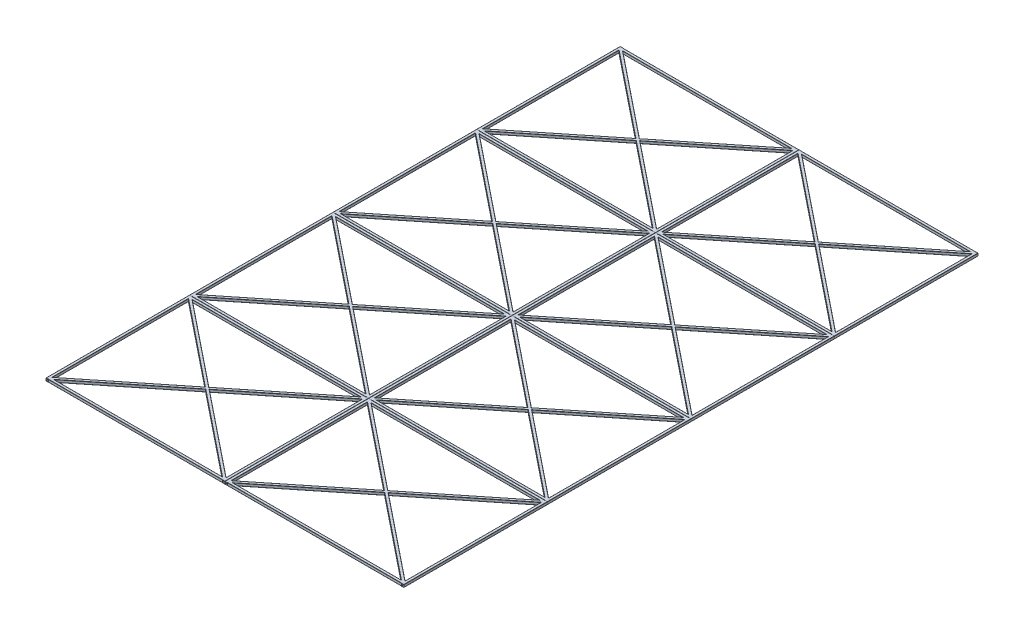
from build123d import *

# Parameters (mm, degrees)
BOSS_EXTRUDE1_DEPTH             = 2125
BOSS_EXTRUDE2_DEPTH             = 2573.8
BOSS_EXTRUDE5_REACH             = 1700.499
BOSS_EXTRUDE5_DIRECTION_2_REACH = 1700.499
BOSS_EXTRUDE7_REACH             = 3326.514
BOSS_EXTRUDE7_DIRECTION_2_REACH = 3326.514
BOSS_EXTRUDE8_REACH             = 3354.589
BOSS_EXTRUDE8_DIRECTION_2_REACH = 3354.589


with BuildPart() as part:
    # Sketch2 → Boss-Extrude1 (new body)
    with BuildSketch(Plane.XY):
        with BuildLine():
            Line((2.540000000000018, 18.93544774013129), (35.55999999999998, 18.93544774013129))
            ThreePointArc((35.55999999999998, 18.93544774013129), (37.35605122421383, 18.191498964345122), (38.1, 16.395447740131274))
            Line((38.1, 16.395447740131274), (38.1, -16.624552259868693))
            ThreePointArc((38.1, -16.624552259868693), (37.35605122421383, -18.42060348408254), (35.55999999999998, -19.16455225986871))
            Line((35.55999999999998, -19.16455225986871), (2.5400000000000222, -19.16455225986871))
            ThreePointArc((2.5400000000000222, -19.16455225986871), (0.7439487757861745, -18.42060348408254), (4.35e-15, -16.624552259868693))
            Line((4.35e-15, -16.624552259868693), (3.1e-16, 16.395447740131274))
            ThreePointArc((3.1e-16, 16.395447740131274), (0.7439487757861709, 18.19149896434512), (2.540000000000018, 18.93544774013129))
        make_face()
        with BuildLine():
            Line((5.308600000000018, 16.166847740131292), (32.791399999999975, 16.166847740131292))
            ThreePointArc((32.791399999999975, 16.166847740131292), (34.58745122421383, 15.422898964345128), (35.3314, 13.626847740131273))
            Line((35.3314, 13.626847740131273), (35.3314, -13.855952259868694))
            ThreePointArc((35.3314, -13.855952259868694), (34.58745122421382, -15.652003484082543), (32.791399999999975, -16.39595225986871))
            Line((32.791399999999975, -16.39595225986871), (5.308600000000018, -16.395952259868707))
            ThreePointArc((5.308600000000018, -16.395952259868707), (3.5125487757861693, -15.652003484082538), (2.7686, -13.85595225986869))
            Line((2.7686, -13.85595225986869), (2.7686, 13.626847740131273))
            ThreePointArc((2.7686, 13.626847740131273), (3.5125487757861693, 15.422898964345121), (5.308600000000018, 16.166847740131292))
        make_face(mode=Mode.SUBTRACT)
    extrude(amount=BOSS_EXTRUDE1_DEPTH)


with BuildPart() as body_2:
    # Mirror2: mirrored copy
    add(part.part.mirror(Plane.ZY.offset(-1325)))


with BuildPart() as part_1:
    add(part.part)

    add(body_2.part)  # Boss-Extrude2 merges body 2
    # Sketch3 → Boss-Extrude2 (add)
    with BuildSketch(Plane.ZY.offset(-2611.9)):
        with BuildLine():
            Line((2.5400000000000182, 18.93544774013129), (35.55999999999999, 18.93544774013129))
            ThreePointArc((35.55999999999999, 18.93544774013129), (37.35605122421383, 18.19149896434512), (38.1, 16.395447740131278))
            Line((38.1, 16.395447740131278), (38.10000000000002, -16.624552259868693))
            ThreePointArc((38.10000000000002, -16.624552259868693), (37.35605122421385, -18.42060348408254), (35.56, -19.16455225986871))
            Line((35.56, -19.16455225986871), (2.5400000000000182, -19.16455225986871))
            ThreePointArc((2.5400000000000182, -19.16455225986871), (0.7439487757861705, -18.42060348408254), (5.3e-16, -16.624552259868693))
            Line((5.3e-16, -16.624552259868693), (5.3e-16, 16.395447740131274))
            ThreePointArc((5.3e-16, 16.395447740131274), (0.7439487757861711, 18.191498964345122), (2.5400000000000182, 18.93544774013129))
        make_face()
        with BuildLine():
            Line((5.308600000000019, 16.166847740131292), (32.791399999999975, 16.166847740131292))
            ThreePointArc((32.791399999999975, 16.166847740131292), (34.58745122421383, 15.422898964345128), (35.3314, 13.626847740131273))
            Line((35.3314, 13.626847740131273), (35.3314, -13.855952259868694))
            ThreePointArc((35.3314, -13.855952259868694), (34.58745122421382, -15.652003484082543), (32.791399999999975, -16.39595225986871))
            Line((32.791399999999975, -16.39595225986871), (5.308600000000017, -16.395952259868707))
            ThreePointArc((5.308600000000017, -16.395952259868707), (3.51254877578617, -15.652003484082538), (2.7686000000000006, -13.85595225986869))
            Line((2.7686000000000006, -13.85595225986869), (2.7686000000000006, 13.626847740131273))
            ThreePointArc((2.7686000000000006, 13.626847740131273), (3.51254877578617, 15.422898964345123), (5.308600000000019, 16.166847740131292))
        make_face(mode=Mode.SUBTRACT)
    boss_extrude2 = extrude(amount=BOSS_EXTRUDE2_DEPTH)

    # Mirror3: Boss-Extrude2 across plane
    add(boss_extrude2.mirror(Plane.XY.offset(1062.5)))

    # Sketch8 → Boss-Extrude5 (add, up to next)
    with BuildSketch(Plane(origin=(1325, 0, 1062.5000000000005), x_dir=(-0.6255921846507733, 0, 0.7801502537997875), z_dir=(-0.7801502537997875, 0, -0.6255921846507733)), mode=Mode.PRIVATE) as boss_extrude5_sk1:
        with BuildLine():
            Line((-16.509999999999987, 18.93544774013129), (16.50999999999998, 18.93544774013129))
            ThreePointArc((16.50999999999998, 18.93544774013129), (18.306051224213828, 18.19149896434512), (19.049999999999997, 16.395447740131274))
            Line((19.049999999999997, 16.395447740131274), (19.05000000000001, -16.624552259868693))
            ThreePointArc((19.05000000000001, -16.624552259868693), (18.306051224213842, -18.42060348408254), (16.509999999999994, -19.16455225986871))
            Line((16.509999999999994, -19.16455225986871), (-16.509999999999984, -19.16455225986871))
            ThreePointArc((-16.509999999999984, -19.16455225986871), (-18.30605122421383, -18.42060348408254), (-19.05, -16.624552259868693))
            Line((-19.05, -16.624552259868693), (-19.050000000000004, 16.395447740131274))
            ThreePointArc((-19.050000000000004, 16.395447740131274), (-18.306051224213835, 18.19149896434512), (-16.509999999999987, 18.93544774013129))
        make_face()
        with BuildLine():
            Line((16.281399999999998, 13.626847740131273), (16.28140000000001, -13.855952259868694))
            ThreePointArc((16.28140000000001, -13.855952259868694), (15.537451224213838, -15.652003484082542), (13.74139999999999, -16.39595225986871))
            Line((13.74139999999999, -16.39595225986871), (-13.741399999999983, -16.39595225986871))
            ThreePointArc((-13.741399999999983, -16.39595225986871), (-15.53745122421383, -15.652003484082542), (-16.2814, -13.855952259868694))
            Line((-16.2814, -13.855952259868694), (-16.281400000000005, 13.626847740131273))
            ThreePointArc((-16.281400000000005, 13.626847740131273), (-15.537451224213836, 15.422898964345123), (-13.741399999999986, 16.166847740131292))
            Line((-13.741399999999986, 16.166847740131292), (13.74139999999998, 16.166847740131292))
            ThreePointArc((13.74139999999998, 16.166847740131292), (15.537451224213829, 15.422898964345123), (16.281399999999998, 13.626847740131273))
        make_face(mode=Mode.SUBTRACT)
    boss_extrude5_tool1 = extrude(boss_extrude5_sk1.sketch, amount=-BOSS_EXTRUDE5_REACH, mode=Mode.PRIVATE) - part_1.part
    add(boss_extrude5_tool1.solids().sort_by_distance((1336.213772, 17.810499, 1048.515767))[0])

    # Sketch8 → Boss-Extrude5 direction 2 (add, up to next)
    with BuildSketch(Plane(origin=(1325, 0, 1062.5000000000005), x_dir=(-0.6255921846507733, 0, 0.7801502537997875), z_dir=(-0.7801502537997875, 0, -0.6255921846507733)), mode=Mode.PRIVATE) as boss_extrude5_direction_2_sk1:
        with BuildLine():
            Line((-16.509999999999987, 18.93544774013129), (16.50999999999998, 18.93544774013129))
            ThreePointArc((16.50999999999998, 18.93544774013129), (18.306051224213828, 18.19149896434512), (19.049999999999997, 16.395447740131274))
            Line((19.049999999999997, 16.395447740131274), (19.05000000000001, -16.624552259868693))
            ThreePointArc((19.05000000000001, -16.624552259868693), (18.306051224213842, -18.42060348408254), (16.509999999999994, -19.16455225986871))
            Line((16.509999999999994, -19.16455225986871), (-16.509999999999984, -19.16455225986871))
            ThreePointArc((-16.509999999999984, -19.16455225986871), (-18.30605122421383, -18.42060348408254), (-19.05, -16.624552259868693))
            Line((-19.05, -16.624552259868693), (-19.050000000000004, 16.395447740131274))
            ThreePointArc((-19.050000000000004, 16.395447740131274), (-18.306051224213835, 18.19149896434512), (-16.509999999999987, 18.93544774013129))
        make_face()
        with BuildLine():
            Line((16.281399999999998, 13.626847740131273), (16.28140000000001, -13.855952259868694))
            ThreePointArc((16.28140000000001, -13.855952259868694), (15.537451224213838, -15.652003484082542), (13.74139999999999, -16.39595225986871))
            Line((13.74139999999999, -16.39595225986871), (-13.741399999999983, -16.39595225986871))
            ThreePointArc((-13.741399999999983, -16.39595225986871), (-15.53745122421383, -15.652003484082542), (-16.2814, -13.855952259868694))
            Line((-16.2814, -13.855952259868694), (-16.281400000000005, 13.626847740131273))
            ThreePointArc((-16.281400000000005, 13.626847740131273), (-15.537451224213836, 15.422898964345123), (-13.741399999999986, 16.166847740131292))
            Line((-13.741399999999986, 16.166847740131292), (13.74139999999998, 16.166847740131292))
            ThreePointArc((13.74139999999998, 16.166847740131292), (15.537451224213829, 15.422898964345123), (16.281399999999998, 13.626847740131273))
        make_face(mode=Mode.SUBTRACT)
    boss_extrude5_direction_2_tool1 = extrude(boss_extrude5_direction_2_sk1.sketch, amount=BOSS_EXTRUDE5_DIRECTION_2_REACH, mode=Mode.PRIVATE) - part_1.part
    add(boss_extrude5_direction_2_tool1.solids().sort_by_distance((1336.213772, 17.810499, 1048.515767))[0])

    # Sketch11 → Boss-Extrude7 (add, up to next)
    with BuildSketch(Plane(origin=(386.9602912678413, 0, -310.2983467713803), x_dir=(-0.6255921846507708, 0, -0.7801502537997894), z_dir=(0.7801502537997894, 0, -0.6255921846507708)), mode=Mode.PRIVATE) as boss_extrude7_sk1:
        with BuildLine():
            Line((-1674.3292893245477, 18.93544774013129), (-1641.3092893245478, 18.93544774013129))
            ThreePointArc((-1641.3092893245478, 18.93544774013129), (-1639.5132381003339, 18.19149896434509), (-1638.7692893245478, 16.395447740131274))
            Line((-1638.7692893245478, 16.395447740131274), (-1638.7692893245478, -16.624552259868693))
            ThreePointArc((-1638.7692893245478, -16.624552259868693), (-1639.5132381003339, -18.420603484082534), (-1641.3092893245478, -19.16455225986871))
            Line((-1641.3092893245478, -19.16455225986871), (-1674.3292893245477, -19.16455225986871))
            ThreePointArc((-1674.3292893245477, -19.16455225986871), (-1676.1253405487616, -18.42060348408251), (-1676.8692893245477, -16.624552259868693))
            Line((-1676.8692893245477, -16.624552259868693), (-1676.8692893245477, 16.395447740131274))
            ThreePointArc((-1676.8692893245477, 16.395447740131274), (-1676.1253405487616, 18.19149896434509), (-1674.3292893245477, 18.93544774013129))
        make_face()
        with BuildLine():
            Line((-1671.5606893245479, 16.166847740131292), (-1644.0778893245479, 16.166847740131292))
            ThreePointArc((-1644.0778893245479, 16.166847740131292), (-1642.281838100334, 15.42289896434509), (-1641.537889324548, 13.626847740131273))
            Line((-1641.537889324548, 13.626847740131273), (-1641.537889324548, -13.855952259868694))
            ThreePointArc((-1641.537889324548, -13.855952259868694), (-1642.281838100334, -15.652003484082535), (-1644.0778893245479, -16.39595225986871))
            Line((-1644.0778893245479, -16.39595225986871), (-1671.5606893245479, -16.39595225986871))
            ThreePointArc((-1671.5606893245479, -16.39595225986871), (-1673.3567405487618, -15.652003484082536), (-1674.1006893245478, -13.855952259868694))
            Line((-1674.1006893245478, -13.855952259868694), (-1674.1006893245478, 13.626847740131273))
            ThreePointArc((-1674.1006893245478, 13.626847740131273), (-1673.3567405487618, 15.422898964345091), (-1671.5606893245479, 16.166847740131292))
        make_face(mode=Mode.SUBTRACT)
    boss_extrude7_tool1 = extrude(boss_extrude7_sk1.sketch, amount=-BOSS_EXTRUDE7_REACH, mode=Mode.PRIVATE) - part_1.part
    add(boss_extrude7_tool1.solids().sort_by_distance((1424.079082, 18.396632, 983.049793))[0])

    # Sketch11 → Boss-Extrude7 direction 2 (add, up to next)
    with BuildSketch(Plane(origin=(386.9602912678413, 0, -310.2983467713803), x_dir=(-0.6255921846507708, 0, -0.7801502537997894), z_dir=(0.7801502537997894, 0, -0.6255921846507708)), mode=Mode.PRIVATE) as boss_extrude7_direction_2_sk1:
        with BuildLine():
            Line((-1674.3292893245477, 18.93544774013129), (-1641.3092893245478, 18.93544774013129))
            ThreePointArc((-1641.3092893245478, 18.93544774013129), (-1639.5132381003339, 18.19149896434509), (-1638.7692893245478, 16.395447740131274))
            Line((-1638.7692893245478, 16.395447740131274), (-1638.7692893245478, -16.624552259868693))
            ThreePointArc((-1638.7692893245478, -16.624552259868693), (-1639.5132381003339, -18.420603484082534), (-1641.3092893245478, -19.16455225986871))
            Line((-1641.3092893245478, -19.16455225986871), (-1674.3292893245477, -19.16455225986871))
            ThreePointArc((-1674.3292893245477, -19.16455225986871), (-1676.1253405487616, -18.42060348408251), (-1676.8692893245477, -16.624552259868693))
            Line((-1676.8692893245477, -16.624552259868693), (-1676.8692893245477, 16.395447740131274))
            ThreePointArc((-1676.8692893245477, 16.395447740131274), (-1676.1253405487616, 18.19149896434509), (-1674.3292893245477, 18.93544774013129))
        make_face()
        with BuildLine():
            Line((-1671.5606893245479, 16.166847740131292), (-1644.0778893245479, 16.166847740131292))
            ThreePointArc((-1644.0778893245479, 16.166847740131292), (-1642.281838100334, 15.42289896434509), (-1641.537889324548, 13.626847740131273))
            Line((-1641.537889324548, 13.626847740131273), (-1641.537889324548, -13.855952259868694))
            ThreePointArc((-1641.537889324548, -13.855952259868694), (-1642.281838100334, -15.652003484082535), (-1644.0778893245479, -16.39595225986871))
            Line((-1644.0778893245479, -16.39595225986871), (-1671.5606893245479, -16.39595225986871))
            ThreePointArc((-1671.5606893245479, -16.39595225986871), (-1673.3567405487618, -15.652003484082536), (-1674.1006893245478, -13.855952259868694))
            Line((-1674.1006893245478, -13.855952259868694), (-1674.1006893245478, 13.626847740131273))
            ThreePointArc((-1674.1006893245478, 13.626847740131273), (-1673.3567405487618, 15.422898964345091), (-1671.5606893245479, 16.166847740131292))
        make_face(mode=Mode.SUBTRACT)
    boss_extrude7_direction_2_tool1 = extrude(boss_extrude7_direction_2_sk1.sketch, amount=BOSS_EXTRUDE7_DIRECTION_2_REACH, mode=Mode.PRIVATE) - part_1.part
    add(boss_extrude7_direction_2_tool1.solids().sort_by_distance((1424.079082, 18.396632, 983.049793))[0])

    # Sketch12 → Boss-Extrude8 (add, up to next)
    with BuildSketch(Plane(origin=(188.80212680269477, 0, -151.39793187008448), x_dir=(-0.6255921846507708, 0, -0.7801502537997894), z_dir=(0.7801502537997894, 0, -0.6255921846507708)), mode=Mode.PRIVATE) as boss_extrude8_sk1:
        with BuildLine():
            Line((-1674.3292893245477, 18.93544774013129), (-1641.3092893245478, 18.93544774013129))
            ThreePointArc((-1641.3092893245478, 18.93544774013129), (-1639.5132381003339, 18.19149896434509), (-1638.7692893245478, 16.395447740131274))
            Line((-1638.7692893245478, 16.395447740131274), (-1638.7692893245478, -16.624552259868693))
            ThreePointArc((-1638.7692893245478, -16.624552259868693), (-1639.5132381003339, -18.420603484082534), (-1641.3092893245478, -19.16455225986871))
            Line((-1641.3092893245478, -19.16455225986871), (-1674.3292893245477, -19.16455225986871))
            ThreePointArc((-1674.3292893245477, -19.16455225986871), (-1676.1253405487616, -18.42060348408251), (-1676.8692893245477, -16.624552259868693))
            Line((-1676.8692893245477, -16.624552259868693), (-1676.8692893245477, 16.395447740131274))
            ThreePointArc((-1676.8692893245477, 16.395447740131274), (-1676.1253405487616, 18.19149896434509), (-1674.3292893245477, 18.93544774013129))
        make_face()
        with BuildLine():
            Line((-1671.5606893245479, 16.166847740131292), (-1644.0778893245479, 16.166847740131292))
            ThreePointArc((-1644.0778893245479, 16.166847740131292), (-1642.281838100334, 15.42289896434509), (-1641.537889324548, 13.626847740131273))
            Line((-1641.537889324548, 13.626847740131273), (-1641.537889324548, -13.855952259868694))
            ThreePointArc((-1641.537889324548, -13.855952259868694), (-1642.281838100334, -15.652003484082535), (-1644.0778893245479, -16.39595225986871))
            Line((-1644.0778893245479, -16.39595225986871), (-1671.5606893245479, -16.39595225986871))
            ThreePointArc((-1671.5606893245479, -16.39595225986871), (-1673.3567405487618, -15.652003484082536), (-1674.1006893245478, -13.855952259868694))
            Line((-1674.1006893245478, -13.855952259868694), (-1674.1006893245478, 13.626847740131273))
            ThreePointArc((-1674.1006893245478, 13.626847740131273), (-1673.3567405487618, 15.422898964345091), (-1671.5606893245479, 16.166847740131292))
        make_face(mode=Mode.SUBTRACT)
    boss_extrude8_tool1 = extrude(boss_extrude8_sk1.sketch, amount=BOSS_EXTRUDE8_REACH, mode=Mode.PRIVATE) - part_1.part
    add(boss_extrude8_tool1.solids().sort_by_distance((1225.920918, 18.396632, 1141.950207))[0])

    # Sketch12 → Boss-Extrude8 direction 2 (add, up to next)
    with BuildSketch(Plane(origin=(188.80212680269477, 0, -151.39793187008448), x_dir=(-0.6255921846507708, 0, -0.7801502537997894), z_dir=(0.7801502537997894, 0, -0.6255921846507708)), mode=Mode.PRIVATE) as boss_extrude8_direction_2_sk1:
        with BuildLine():
            Line((-1674.3292893245477, 18.93544774013129), (-1641.3092893245478, 18.93544774013129))
            ThreePointArc((-1641.3092893245478, 18.93544774013129), (-1639.5132381003339, 18.19149896434509), (-1638.7692893245478, 16.395447740131274))
            Line((-1638.7692893245478, 16.395447740131274), (-1638.7692893245478, -16.624552259868693))
            ThreePointArc((-1638.7692893245478, -16.624552259868693), (-1639.5132381003339, -18.420603484082534), (-1641.3092893245478, -19.16455225986871))
            Line((-1641.3092893245478, -19.16455225986871), (-1674.3292893245477, -19.16455225986871))
            ThreePointArc((-1674.3292893245477, -19.16455225986871), (-1676.1253405487616, -18.42060348408251), (-1676.8692893245477, -16.624552259868693))
            Line((-1676.8692893245477, -16.624552259868693), (-1676.8692893245477, 16.395447740131274))
            ThreePointArc((-1676.8692893245477, 16.395447740131274), (-1676.1253405487616, 18.19149896434509), (-1674.3292893245477, 18.93544774013129))
        make_face()
        with BuildLine():
            Line((-1671.5606893245479, 16.166847740131292), (-1644.0778893245479, 16.166847740131292))
            ThreePointArc((-1644.0778893245479, 16.166847740131292), (-1642.281838100334, 15.42289896434509), (-1641.537889324548, 13.626847740131273))
            Line((-1641.537889324548, 13.626847740131273), (-1641.537889324548, -13.855952259868694))
            ThreePointArc((-1641.537889324548, -13.855952259868694), (-1642.281838100334, -15.652003484082535), (-1644.0778893245479, -16.39595225986871))
            Line((-1644.0778893245479, -16.39595225986871), (-1671.5606893245479, -16.39595225986871))
            ThreePointArc((-1671.5606893245479, -16.39595225986871), (-1673.3567405487618, -15.652003484082536), (-1674.1006893245478, -13.855952259868694))
            Line((-1674.1006893245478, -13.855952259868694), (-1674.1006893245478, 13.626847740131273))
            ThreePointArc((-1674.1006893245478, 13.626847740131273), (-1673.3567405487618, 15.422898964345091), (-1671.5606893245479, 16.166847740131292))
        make_face(mode=Mode.SUBTRACT)
    boss_extrude8_direction_2_tool1 = extrude(boss_extrude8_direction_2_sk1.sketch, amount=-BOSS_EXTRUDE8_DIRECTION_2_REACH, mode=Mode.PRIVATE) - part_1.part
    add(boss_extrude8_direction_2_tool1.solids().sort_by_distance((1225.920918, 18.396632, 1141.950207))[0])


with BuildPart() as body_2_2:
    # Mirror4: mirrored copy
    add(part_1.part.mirror(Plane(origin=(35.56, -16.62455225986871, 2125), x_dir=(1, 0, 0), z_dir=(0, 0, -1))))


with BuildPart() as body_3:
    # Mirror5: mirrored copy
    add(body_2_2.part.mirror(Plane(origin=(35.56, -16.62455225986871, 4250), x_dir=(1, 0, 0), z_dir=(0, 0, 1))))


with BuildPart() as body_4:
    # Mirror6: mirrored copy
    add(body_3.part.mirror(Plane(origin=(2650.0000000000005, 16.395447740131274, 2125.0000000000005), x_dir=(-2.1e-16, 0, 1), z_dir=(-1, 1.2e-16, -2.1e-16))))


with BuildPart() as body_5:
    # Mirror6 2: mirrored copy
    add(body_2_2.part.mirror(Plane(origin=(2650.0000000000005, 16.395447740131274, 2125.0000000000005), x_dir=(-2.1e-16, 0, 1), z_dir=(-1, 1.2e-16, -2.1e-16))))


with BuildPart() as body_6:
    # Mirror6 3: mirrored copy
    add(part_1.part.mirror(Plane(origin=(2650.0000000000005, 16.395447740131274, 2125.0000000000005), x_dir=(-2.1e-16, 0, 1), z_dir=(-1, 1.2e-16, -2.1e-16))))


with BuildPart() as body_7:
    # Mirror7: mirrored copy
    add(body_3.part.mirror(Plane(origin=(35.56, -16.62455225986871, 6375), x_dir=(1, 0, 0), z_dir=(0, 0, -1))))


with BuildPart() as body_8:
    # Mirror7 2: mirrored copy
    add(body_4.part.mirror(Plane(origin=(35.56, -16.62455225986871, 6375), x_dir=(1, 0, 0), z_dir=(0, 0, -1))))


solid = Compound([part_1.part, body_2_2.part, body_3.part, body_4.part, body_5.part, body_6.part, body_7.part, body_8.part])
